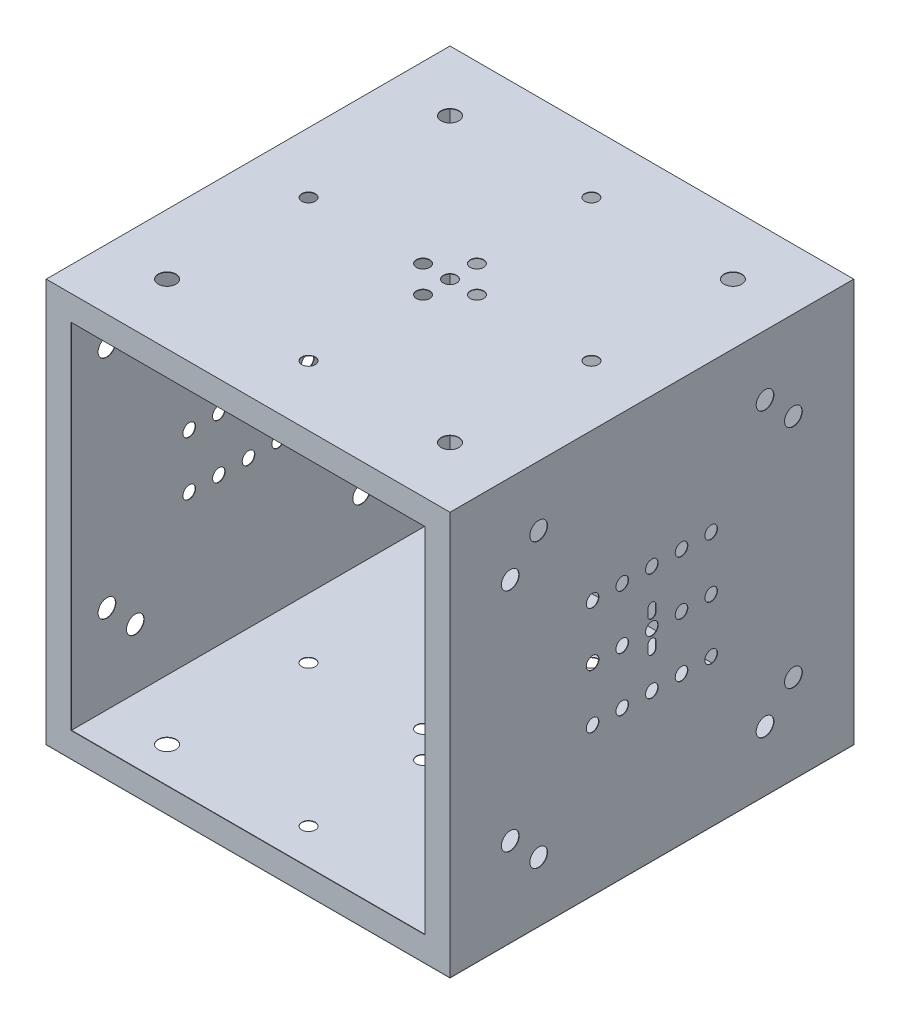
from build123d import *

# Parameters (mm, degrees)
SKETCH1_W           = 2997
SKETCH1_H           = 2994
BOSS_EXTRUDE1_DEPTH = 2997
SHELL1_T            = -3
SKETCH2_W           = 2997
SKETCH2_H           = 2994
SKETCH2_W_2         = 2626.629258518
SKETCH2_H_2         = 2624
BOSS_EXTRUDE2_DEPTH = 3
SKETCH3_R           = 46.75
SKETCH3_R_2         = 65.8
CUT_EXTRUDE1_DEPTH  = 4496.000222469
SKETCH4_R           = 49.85
SKETCH4_R_2         = 65.8
CUT_EXTRUDE2_DEPTH  = 4494.500556359
SKETCH5_R           = 91.2
SKETCH5_R_2         = 35.635
SKETCH5_R_3         = 65.8
CUT_EXTRUDE3_DEPTH  = 3670.948262578


with BuildPart() as part:
    # Sketch1 → Boss-Extrude1 (new body)
    with BuildSketch(Plane.XY):
        Rectangle(SKETCH1_W, SKETCH1_H)
    extrude(amount=BOSS_EXTRUDE1_DEPTH)

    # Shell1
    shell1_openings = [part.faces().sort_by_distance(p)[0] for p in [
        (0, 0, 2997),
    ]]
    offset(amount=SHELL1_T, openings=shell1_openings, kind=Kind.INTERSECTION)

    # Sketch2 → Boss-Extrude2 (add)
    with BuildSketch(Plane.XY.offset(2997)):
        Rectangle(SKETCH2_W, SKETCH2_H)
        Rectangle(SKETCH2_W_2, SKETCH2_H_2, mode=Mode.SUBTRACT)
    extrude(amount=-BOSS_EXTRUDE2_DEPTH)

    # Sketch3 → Cut-Extrude1 (cut, through all)
    with BuildSketch(Plane.ZY.offset(1498.5)):
        with Locations((1498.5, 0)):
            Circle(SKETCH3_R)
        with Locations((1278.5, 0)):
            Circle(SKETCH3_R)
        with Locations((1058.5, 0)):
            Circle(SKETCH3_R)
        with Locations((1058.5, 400)):
            Circle(SKETCH3_R)
        with Locations((1278.5, 400)):
            Circle(SKETCH3_R)
        with Locations((1498.5, 400)):
            Circle(SKETCH3_R)
        with Locations((658.5, 1050)):
            Circle(SKETCH3_R_2)
        with Locations((447.659264897, 838.948001635)):
            Circle(SKETCH3_R_2)
        with Locations((1718.5, 400)):
            Circle(SKETCH3_R)
        with Locations((1718.5, 0)):
            Circle(SKETCH3_R)
        with Locations((1938.5, 0)):
            Circle(SKETCH3_R)
        with Locations((1938.5, 400)):
            Circle(SKETCH3_R)
        with Locations((2549.340735103, 838.948001635)):
            Circle(SKETCH3_R_2)
        with Locations((2338.5, 1050)):
            Circle(SKETCH3_R_2)
        with Locations((1058.5, -400)):
            Circle(SKETCH3_R)
        with Locations((1278.5, -400)):
            Circle(SKETCH3_R)
        with Locations((1498.5, -400)):
            Circle(SKETCH3_R)
        with Locations((1718.5, -400)):
            Circle(SKETCH3_R)
        with Locations((1938.5, -400)):
            Circle(SKETCH3_R)
        with Locations((2549.340735103, -838.948001635)):
            Circle(SKETCH3_R_2)
        with Locations((2338.5, -1050)):
            Circle(SKETCH3_R_2)
        with Locations((658.5, -1050)):
            Circle(SKETCH3_R_2)
        with Locations((447.659264897, -838.948001635)):
            Circle(SKETCH3_R_2)
        with BuildLine():
            Line((1468.5, 92.5), (1468.5, 140))
            ThreePointArc((1468.5, 140), (1498.5, 170), (1528.5, 140))
            Line((1528.5, 140), (1528.5, 92.5))
            ThreePointArc((1528.5, 92.5), (1498.5, 62.5), (1468.5, 92.5))
        make_face()
        with BuildLine():
            Line((1468.5, -92.5), (1468.5, -140))
            ThreePointArc((1468.5, -140), (1498.5, -170), (1528.5, -140))
            Line((1528.5, -140), (1528.5, -92.5))
            ThreePointArc((1528.5, -92.5), (1498.5, -62.5), (1468.5, -92.5))
        make_face()
    extrude(amount=-CUT_EXTRUDE1_DEPTH, mode=Mode.SUBTRACT)

    # Sketch4 → Cut-Extrude2 (cut, through all)
    with BuildSketch(Plane(origin=(0, 1497, 0), x_dir=(1, 0, 0), z_dir=(0, 1, 0))):
        with Locations((0, -1498.5)):
            Circle(SKETCH4_R)
        with Locations((-200, -1498.5)):
            Circle(SKETCH4_R)
        with Locations((-1050, -1498.5)):
            Circle(SKETCH4_R)
        with Locations((-1050, -448.5)):
            Circle(SKETCH4_R_2)
        with Locations((200, -1498.5)):
            Circle(SKETCH4_R)
        with Locations((1050, -1498.5)):
            Circle(SKETCH4_R)
        with Locations((1050, -448.5)):
            Circle(SKETCH4_R_2)
        with Locations((0, -2548.5)):
            Circle(SKETCH4_R)
        with Locations((0, -1698.5)):
            Circle(SKETCH4_R)
        with Locations((0, -1298.5)):
            Circle(SKETCH4_R)
        with Locations((0, -448.5)):
            Circle(SKETCH4_R)
        with Locations((1050, -2548.5)):
            Circle(SKETCH4_R_2)
        with Locations((-1050, -2548.5)):
            Circle(SKETCH4_R_2)
    extrude(amount=-CUT_EXTRUDE2_DEPTH, mode=Mode.SUBTRACT)

    # Sketch5 → Cut-Extrude3 (cut, through all)
    with BuildSketch(Plane(origin=(0, 0, 0), x_dir=(-1, 0, 0), z_dir=(0, 0, -1))):
        Circle(SKETCH5_R)
        with Locations((0, 140)):
            Circle(SKETCH5_R_2)
        with Locations((-222, 382)):
            Circle(SKETCH5_R)
        with Locations((222, -382)):
            Circle(SKETCH5_R)
        with Locations((-900, 899.099099099)):
            Circle(SKETCH5_R_3)
        with Locations((0, -140)):
            Circle(SKETCH5_R_2)
        with Locations((-900, -899.099099099)):
            Circle(SKETCH5_R_3)
        with Locations((900, -899.099099099)):
            Circle(SKETCH5_R_3)
        with Locations((900, 899.099099099)):
            Circle(SKETCH5_R_3)
    extrude(amount=-CUT_EXTRUDE3_DEPTH, mode=Mode.SUBTRACT)


with BuildPart() as body_2:
    # Split1: the piece on the far side of the plane
    add(part.part)
    split(bisect_by=Plane(origin=(-1498.5, -1494, 2997), x_dir=(0, 0, 1), z_dir=(0, 1, 0)), keep=Keep.BOTTOM)


with BuildPart() as part_1:
    add(part.part)

    # Split1
    split(bisect_by=Plane(origin=(-1498.5, -1494, 2997), x_dir=(0, 0, 1), z_dir=(0, 1, 0)), keep=Keep.TOP)


solid = Compound([body_2.part, part_1.part])
